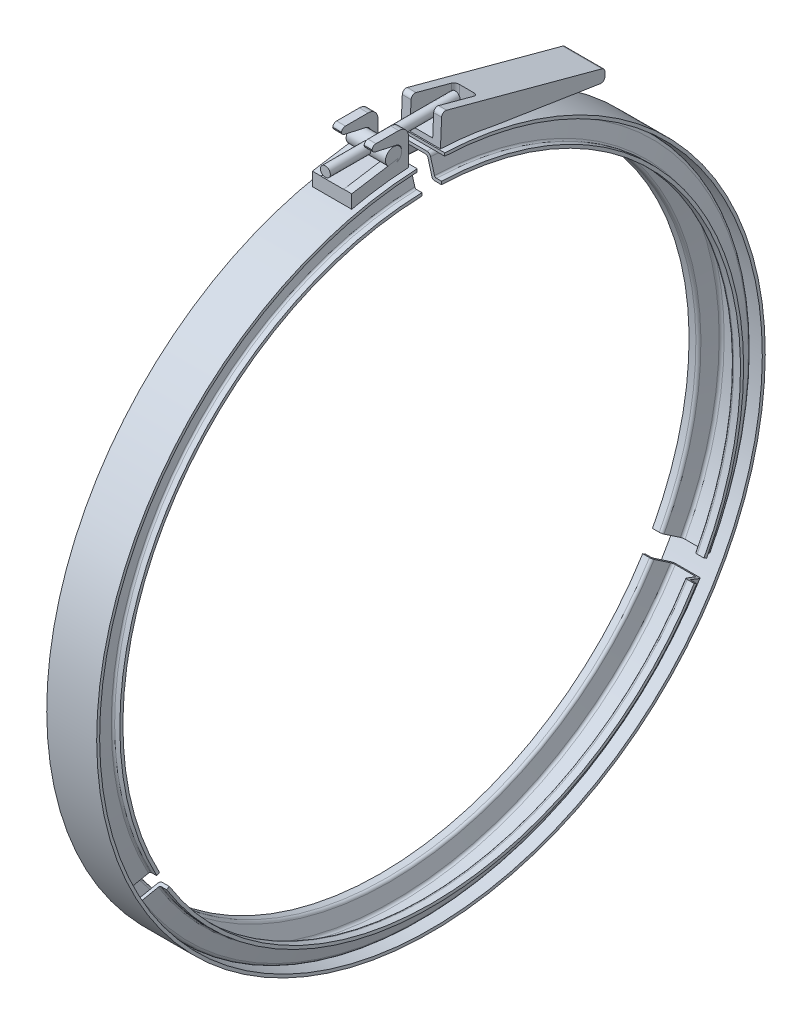
from build123d import *

# Parameters (mm, degrees)
EXTRUDE1_DEPTH   = 20
EXTRUDE6_DEPTH   = 12.7
EXTRUDE7_DEPTH   = 10
EXTRUDE7_2_DEPTH = 10
SKETCH7_W        = 11.48721415
SKETCH7_H        = 74.825141816
EXTRUDE8_DEPTH   = 16
SHELL1_START     = -8
SHELL1_DEPTH     = 16
SHELL1_2_DEPTH   = 0.459658732
SHELL1_START_2   = 7.946872882
SHELL1_3_DEPTH   = 0.053127118
FILLET3_R        = 2
FILLET4_R        = 5
FILLET5_R        = 2
FILLET6_R        = 2
SKETCH8_R        = 2.519183854
EXTRUDE9_DEPTH   = 66
SKETCH9_R        = 4.117449305
EXTRUDE10_DEPTH  = 20


# Read off the part's stored shape, not the designer's step: Shell1
with BuildPart() as part:
    # Sweep1: sweep along a path in Sketch1
    with BuildLine(Plane(origin=(0, 0, 0), x_dir=(0, 0, -1), z_dir=(1, 0, 0))) as sweep1_path:
        CenterArc((0, 0), 166.56, 0, 360)
    # Sketch2 → Sweep1 (sweep)
    with BuildSketch(Plane.XY):
        with BuildLine():
            Line((-4.754009518, -166.56), (4.754009518, -166.56))
            ThreePointArc((4.754009518, -166.56), (5.667151662, -166.25003001), (6.202898257, -165.448228568))
            Line((6.202898257, -165.448228568), (8.157978054, -158.151771432))
            ThreePointArc((8.157978054, -158.151771432), (8.69372465, -157.34996999), (9.606866794, -157.04))
            Line((9.606866794, -157.04), (13.08, -157.04))
            Line((13.08, -157.04), (13.08, -158.61))
            Line((13.08, -158.61), (10.427906671, -158.61))
            ThreePointArc((10.427906671, -158.61), (9.819145242, -158.81664666), (9.461980845, -159.351180955))
            Line((9.461980845, -159.351180955), (7.506901048, -166.64763809))
            ThreePointArc((7.506901048, -166.64763809), (6.792572253, -167.716706681), (5.575049395, -168.13))
            Line((5.575049395, -168.13), (-5.575049395, -168.13))
            ThreePointArc((-5.575049395, -168.13), (-6.792572253, -167.716706681), (-7.506901048, -166.64763809))
            Line((-7.506901048, -166.64763809), (-9.461980845, -159.351180955))
            ThreePointArc((-9.461980845, -159.351180955), (-9.819145242, -158.81664666), (-10.427906671, -158.61))
            Line((-10.427906671, -158.61), (-13.08, -158.61))
            Line((-13.08, -158.61), (-13.08, -157.04))
            Line((-13.08, -157.04), (-9.606866794, -157.04))
            ThreePointArc((-9.606866794, -157.04), (-8.69372465, -157.34996999), (-8.157978054, -158.151771432))
            Line((-8.157978054, -158.151771432), (-6.202898257, -165.448228568))
            ThreePointArc((-6.202898257, -165.448228568), (-5.667151662, -166.25003001), (-4.754009518, -166.56))
        make_face()
    sweep(path=sweep1_path.line)

    # Sketch3 → Extrude1 (cut, symmetric)
    with BuildSketch(Plane(origin=(0, 0, 0), x_dir=(0, 0, -1), z_dir=(1, 0, 0))):
        Polygon((-5, 175.427579487), (5, 175.427579487), (5, 2.886751346), (190.606040774, -104.272946258), (185.606040774, -112.933200296), (5, -8.660254038), (-5, -8.660254038), (-177.930726492, -108.501855529), (-182.930726492, -99.841601491), (-5, 2.886751346), align=None)
    extrude(amount=EXTRUDE1_DEPTH, both=True, mode=Mode.SUBTRACT)


with BuildPart() as extrude1_piece_1:
    # of the separate pieces the step leaves, piece 1, a body of its own (extrude1_pieces)
    add(part.part.solids().sort_by_distance((-4.754009518, 166.484935054, 5))[0])


with BuildPart() as extrude1_piece_2:
    # of the separate pieces the step leaves, piece 2, a body of its own (extrude1_pieces)
    add(part.part.solids().sort_by_distance((-6.202898257, -87.016456506, -140.716923763))[0])


with BuildPart() as extrude1_piece_3:
    # of the separate pieces the step leaves, piece 3, a body of its own (extrude1_pieces)
    add(part.part.solids().sort_by_distance((-6.202898257, 165.372658974, -5))[0])


with BuildPart() as body_4:
    # Sketch4 → Extrude6 (new, symmetric)
    with BuildSketch(Plane(origin=(0, 0, 0), x_dir=(0, 0, -1), z_dir=(1, 0, 0))):
        with BuildLine():
            Line((-7, 169.855821213), (-7, 168.354536618))
            ThreePointArc((-7, 168.354536618), (0, -168.5), (7, 168.354536618))
            Line((7, 168.354536618), (7, 169.855821213))
            ThreePointArc((7, 169.855821213), (0, -170), (-7, 169.855821213))
        make_face()
    extrude(amount=EXTRUDE6_DEPTH, both=True)


with BuildPart() as body_5:
    # Sketch6 → Extrude7 (new, symmetric)
    with BuildSketch(Plane(origin=(0, 0, 0), x_dir=(0, 0, -1), z_dir=(1, 0, 0))):
        with BuildLine():
            Line((7.50859845, 169.972426658), (8.221117728, 186.101752473))
            Line((8.221117728, 186.101752473), (91.161361695, 163.761554088))
            Line((91.161361695, 163.761554088), (91.161361695, 157.650487662))
            Line((91.161361695, 157.650487662), (35.413771382, 166.411747395))
            ThreePointArc((35.413771382, 166.411747395), (21.534903464, 168.769821969), (7.50859845, 169.972426658))
        make_face()
    extrude(amount=EXTRUDE7_DEPTH, both=True)


with BuildPart() as body_6:
    # Sketch6 → Extrude7 2 (new, symmetric)
    with BuildSketch(Plane(origin=(0, 0, 0), x_dir=(0, 0, -1), z_dir=(1, 0, 0))):
        with BuildLine():
            Line((-8.72002371, 169.914584604), (-8.72002371, 188.666722612))
            Line((-8.72002371, 188.666722612), (-27.275684957, 188.666722612))
            Line((-27.275684957, 188.666722612), (-27.275684957, 185.547347364))
            Line((-27.275684957, 185.547347364), (-14.976431767, 182.830610189))
            ThreePointArc((-14.976431767, 182.830610189), (-12.324089515, 180.063313762), (-13.866863737, 176.55436853))
            Line((-13.866863737, 176.55436853), (-37.612454165, 172.754537587))
            Line((-37.612454165, 172.754537587), (-37.612454165, 165.92862371))
            ThreePointArc((-37.612454165, 165.92862371), (-23.25180848, 168.541859124), (-8.72002371, 169.914584604))
        make_face()
    extrude(amount=EXTRUDE7_2_DEPTH, both=True)


with BuildPart() as extrude8_tool:
    # Sketch7 → Extrude8 (new body)
    with BuildSketch(Plane(origin=(0, 188.666722612, 0), x_dir=(1, 0, 0), z_dir=(0, 1, 0))):
        with Locations((0.203265807, -6.771215435)):
            Rectangle(SKETCH7_W, SKETCH7_H)
    extrude(amount=-EXTRUDE8_DEPTH)


with BuildPart() as body_5_1:
    add(body_5.part)

    # Extrude8: cut by extrude8_tool
    add(extrude8_tool.part, mode=Mode.SUBTRACT)

    # Shell1 outline → Shell1 (cut)
    with BuildSketch(Plane.YZ.offset(SHELL1_START)):
        with BuildLine():
            Line((170.666722612, -32.641355473), (170.666722612, -22.45946218))
            ThreePointArc((170.666722612, -22.45946218), (167.828969208, -38.275249745), (163.528852789, -53.757529275))
            Line((163.528852789, -53.757529275), (157.96480653, -89.161361695))
            Line((157.96480653, -89.161361695), (162.228979196, -89.161361695))
            Line((162.228979196, -89.161361695), (177.452808924, -32.641355473))
            Line((177.452808924, -32.641355473), (170.666722612, -32.641355473))
        make_face()
    extrude(amount=SHELL1_DEPTH, mode=Mode.SUBTRACT)

    # Shell1 2 outline → Shell1 2 (cut)
    with BuildSketch(Plane.YZ.offset(SHELL1_START)):
        with BuildLine():
            Line((183.521937086, -10.109103888), (171.870605698, -9.594401766))
            ThreePointArc((171.870605698, -9.594401766), (171.389418478, -16.038231888), (170.666722612, -22.45946218))
            Line((170.666722612, -22.45946218), (170.666722612, -32.641355473))
            Line((170.666722612, -32.641355473), (177.452808924, -32.641355473))
            Line((177.452808924, -32.641355473), (183.521937086, -10.109103888))
        make_face()
    extrude(amount=SHELL1_2_DEPTH, mode=Mode.SUBTRACT)

    # Shell1 3 outline → Shell1 3 (cut)
    with BuildSketch(Plane.YZ.offset(SHELL1_START_2)):
        with BuildLine():
            Line((183.521937086, -10.109103888), (171.870605698, -9.594401766))
            ThreePointArc((171.870605698, -9.594401766), (171.389418478, -16.038231888), (170.666722612, -22.45946218))
            Line((170.666722612, -22.45946218), (170.666722612, -32.641355473))
            Line((170.666722612, -32.641355473), (177.452808924, -32.641355473))
            Line((177.452808924, -32.641355473), (183.521937086, -10.109103888))
        make_face()
    extrude(amount=SHELL1_3_DEPTH, mode=Mode.SUBTRACT)

    # Fillet5
    # the kernel refuses this fillet: 2 mm, written as the material it takes off along each edge
    with BuildSketch(Plane(origin=(-15.847168248, 157.650487662, -91.161361695), x_dir=(0, 0.15525381506481242, 0.9878746139606083), z_dir=(1, 0, 0))) as fillet5_piece_1:
        with BuildLine():
            CenterArc((FILLET5_R * 1.16943364951, -FILLET5_R), FILLET5_R, 90, 98.931516986)
            Line((FILLET5_R * 0.181559035552, -FILLET5_R * 1.15525381506), (0, 0))
            Line((0, 0), (FILLET5_R * 1.16943364951, 0))
        make_face()
    extrude(amount=31.694336495, mode=Mode.SUBTRACT)
    with BuildSketch(Plane(origin=(13.831437231, 163.761554088, -91.161361695), x_dir=(0, 0.26008346339432964, 0.9655861391242163), z_dir=(-1, 0, 0))) as fillet5_piece_2:
        with BuildLine():
            CenterArc((FILLET5_R * 0.766287446169, -FILLET5_R), FILLET5_R, 90, 74.924985377)
            Line((-FILLET5_R * 0.199298692955, -FILLET5_R * 0.739916536606), (0, 0))
            Line((0, 0), (FILLET5_R * 0.766287446169, 0))
        make_face()
    extrude(amount=27.662874462, mode=Mode.SUBTRACT)
    with BuildSketch(Plane(origin=(16.234951469, 186.101752473, -8.221117728), x_dir=(0, -0.9990256931665743, 0.044132350866976804), z_dir=(-1, 0, 0))) as fillet5_piece_3:
        with BuildLine():
            CenterArc((FILLET5_R * 1.24699029387, -FILLET5_R), FILLET5_R, 90, 102.545595649)
            Line((FILLET5_R * 0.270866837259, -FILLET5_R * 1.21721647601), (0, 0))
            Line((0, 0), (FILLET5_R * 1.24699029387, 0))
        make_face()
    extrude(amount=16.523030057, mode=Mode.SUBTRACT)
    with BuildSketch(Plane(origin=(0.694610201, 186.101752473, -8.221117728), x_dir=(0, -0.9990256931665743, 0.044132350866976804), z_dir=(-1, 0, 0))) as fillet5_piece_4:
        with BuildLine():
            CenterArc((FILLET5_R * 1.24699029387, -FILLET5_R), FILLET5_R, 90, 102.545595649)
            Line((FILLET5_R * 0.270866837259, -FILLET5_R * 1.21721647601), (0, 0))
            Line((0, 0), (FILLET5_R * 1.24699029387, 0))
        make_face()
    extrude(amount=16.929561671, mode=Mode.SUBTRACT)

    # Fillet6
    fillet6_edges = [body_5_1.edges().sort_by_distance(p)[0] for p in [
        (-5.540341268, 176.36475909, -30.641355473),
        (5.946872882, 176.36475909, -30.641355473),
    ]]
    fillet(fillet6_edges, radius=FILLET6_R)


with BuildPart() as body_6_1:
    add(body_6.part)

    # Extrude8: cut by extrude8_tool
    add(extrude8_tool.part, mode=Mode.SUBTRACT)

    # Fillet3
    # the kernel refuses this fillet: 2 mm, written as the material it takes off along each edge
    with BuildSketch(Plane(origin=(-15, 188.666722612, 27.275684957), x_dir=(0, 0, -1), z_dir=(1, 0, 0))) as fillet3_piece_1:
        with BuildLine():
            CenterArc((FILLET3_R, -FILLET3_R), FILLET3_R, 90, 90)
            Line((0, -FILLET3_R), (0, 0))
            Line((0, 0), (FILLET3_R, 0))
        make_face()
    extrude(amount=14.459658732, mode=Mode.SUBTRACT)
    with BuildSketch(Plane(origin=(0.946872882, 188.666722612, 27.275684957), x_dir=(0, 0, -1), z_dir=(1, 0, 0))) as fillet3_piece_2:
        with BuildLine():
            CenterArc((FILLET3_R, -FILLET3_R), FILLET3_R, 90, 90)
            Line((0, -FILLET3_R), (0, 0))
            Line((0, 0), (FILLET3_R, 0))
        make_face()
    extrude(amount=14.053127118, mode=Mode.SUBTRACT)
    with BuildSketch(Plane(origin=(1.930780304, 185.547347364, 27.275684957), x_dir=(0, 1, 0), z_dir=(1, 0, 0))) as fillet3_piece_3:
        with BuildLine():
            CenterArc((FILLET3_R * 0.803218515592, -FILLET3_R), FILLET3_R, 90, 77.544150724)
            Line((-FILLET3_R * 0.17324398472, -FILLET3_R * 0.784312760031), (0, 0))
            Line((0, 0), (FILLET3_R * 0.803218515592, 0))
        make_face()
    extrude(amount=12.085312274, mode=Mode.SUBTRACT)
    with BuildSketch(Plane(origin=(-14.016092578, 185.547347364, 27.275684957), x_dir=(0, 1, 0), z_dir=(1, 0, 0))) as fillet3_piece_4:
        with BuildLine():
            CenterArc((FILLET3_R * 0.803218515592, -FILLET3_R), FILLET3_R, 90, 77.544150724)
            Line((-FILLET3_R * 0.17324398472, -FILLET3_R * 0.784312760031), (0, 0))
            Line((0, 0), (FILLET3_R * 0.803218515592, 0))
        make_face()
    extrude(amount=12.491843888, mode=Mode.SUBTRACT)

    # Fillet4
    fillet4_edges = [body_6_1.edges().sort_by_distance(p)[0] for p in [
        (7.973436441, 188.666722612, 8.72002371),
        (-7.770170634, 188.666722612, 8.72002371),
    ]]
    fillet(fillet4_edges, radius=FILLET4_R)


with BuildPart() as body_7:
    # Sketch8 → Extrude9 (new body)
    with BuildSketch(Plane.XY.offset(-25)):
        with Locations((0, 179.251537845)):
            Circle(SKETCH8_R)
    extrude(amount=EXTRUDE9_DEPTH)

    # Sketch9 → Extrude10 (add)
    with BuildSketch(Plane.ZY.offset(10)):
        with Locations((16.323666749, 178.748336006)):
            Circle(SKETCH9_R)
    extrude(amount=-EXTRUDE10_DEPTH)


solid = Compound([extrude1_piece_1.part, extrude1_piece_2.part, extrude1_piece_3.part, body_4.part, body_5_1.part, body_6_1.part, body_7.part])
